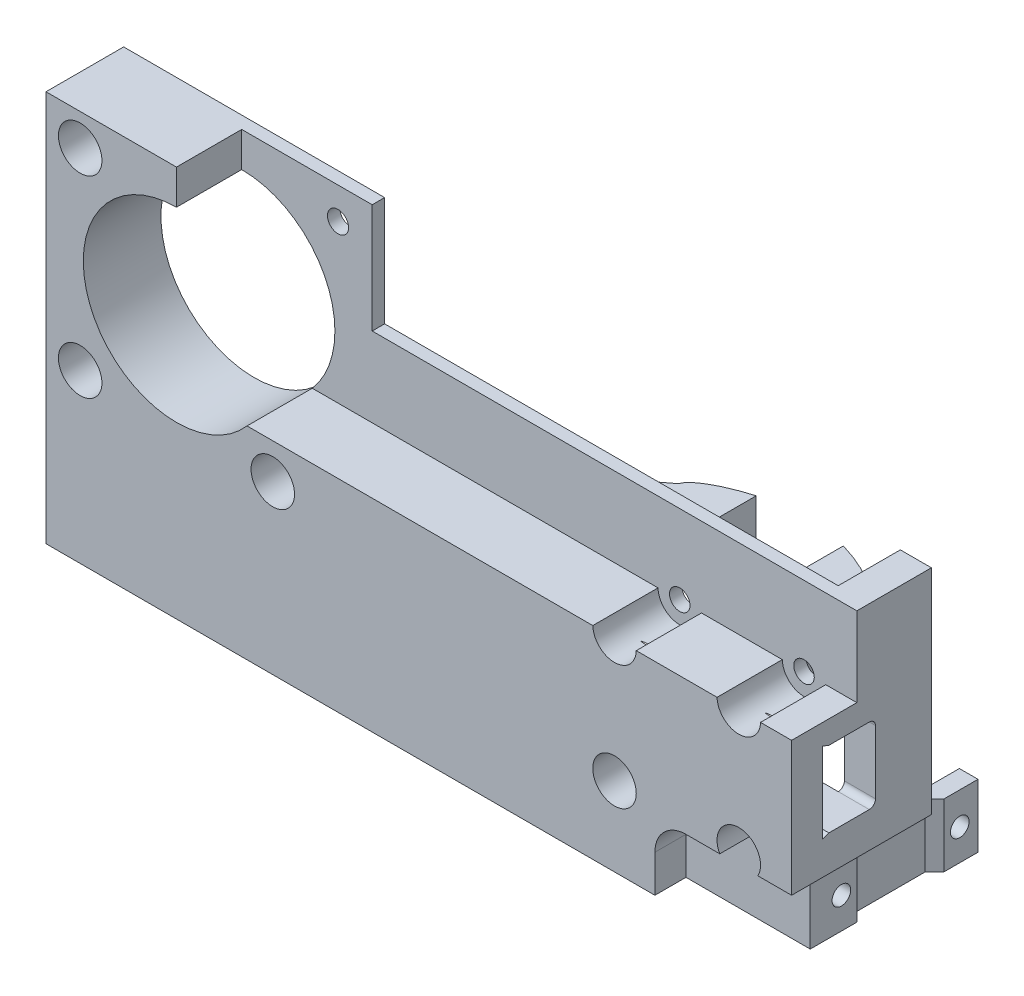
from build123d import *

# Parameters (mm, degrees)
SKETCH1_W               = 120
SKETCH1_H               = 45.4
BOSS_EXTRUDE1_DEPTH     = 12.5
SKETCH2_W               = 5
SKETCH2_H               = 45.4
BOSS_EXTRUDE2_DEPTH     = 10
CUT_EXTRUDE1_DEPTH      = 7.5
CUT_EXTRUDE1_DEPTH_BACK = 129.908533465
SKETCH3_W               = 78
SKETCH3_H               = 12.2
BOSS_EXTRUDE3_START     = -12.5
SKETCH4_W               = 42
SKETCH4_H               = 41
BOSS_EXTRUDE3_DEPTH     = 12.5
SKETCH5_R               = 15
SKETCH5_R_2             = 1.7
CUT_EXTRUDE2_DEPTH      = 138.38722648
SKETCH7_W               = 30
SKETCH7_H               = 8
BOSS_EXTRUDE4_DEPTH     = 44.5
SKETCH8_R               = 1.65
CUT_EXTRUDE4_DEPTH      = 148.030609058
FILLET1_SIZE            = 15
FILLET1_SIZE_2          = 6
SKETCH9_R               = 2.599999999
SKETCH9_R_2             = 12.000000007
CUT_EXTRUDE5_DEPTH      = 10
SKETCH10_R              = 3.5
CUT_EXTRUDE6_DEPTH      = 10.5
SKETCH12_R              = 3.5
CUT_EXTRUDE7_DEPTH      = 7.5
SKETCH6_W               = 105.644224039
SKETCH6_H               = 30.4
CUT_EXTRUDE3_DEPTH      = 10.5
CHAMFER1_SIZE           = 5
CHAMFER1_SIZE2          = 13.737387097
SKETCH13_W              = 14
SKETCH13_H              = 32.158687744
CUT_EXTRUDE8_DEPTH      = 10
SKETCH16_W              = 22.5
SKETCH16_H              = 11
CUT_EXTRUDE9_DEPTH      = 2
SKETCH18_W              = 3
SKETCH18_H              = 10.169703164
BOSS_EXTRUDE7_DEPTH     = 9.5
CUT_EXTRUDE10_REACH     = 144.298
SKETCH19_W              = 1.5
SKETCH19_H              = 14
SKETCH20_W              = 20
SKETCH20_H              = 5
CUT_EXTRUDE11_DEPTH     = 11
SKETCH21_R              = 1.5
CUT_EXTRUDE12_DEPTH     = 7
CHAMFER3_SIZE           = 1.5
FILLET3_R               = 5
CUT_EXTRUDE16_REACH     = 144.298
SKETCH24_W              = 5
SKETCH24_H              = 9
BOSS_EXTRUDE8_DEPTH     = 12.2
FILLET4_R               = 1
SKETCH15_R              = 2.75
BOSS_EXTRUDE9_DEPTH     = 2
CHAMFER4_SIZE           = 2
CHAMFER5_DEPTH          = 8


with BuildPart() as part:
    # Sketch1 → Boss-Extrude1 (new body)
    with BuildSketch(Plane.XY):
        with Locations((60, 22.7)):
            Rectangle(SKETCH1_W, SKETCH1_H)
    extrude(amount=BOSS_EXTRUDE1_DEPTH)

    # Sketch2 → Boss-Extrude2 (add)
    with BuildSketch(Plane(origin=(0, 0, 0), x_dir=(-1, 0, 0), z_dir=(0, 0, -1))):
        with Locations((-117.5, 22.7)):
            Rectangle(SKETCH2_W, SKETCH2_H)
    extrude(amount=BOSS_EXTRUDE2_DEPTH)

    # Sketch3 → Cut-Extrude1 (cut, two sides: drawn at the far end of the back side and taken through both)
    with BuildSketch(Plane.XY.offset(-CUT_EXTRUDE1_DEPTH_BACK)):
        with Locations((81, 22.8)):
            Rectangle(SKETCH3_W, SKETCH3_H)
    extrude(amount=CUT_EXTRUDE1_DEPTH + CUT_EXTRUDE1_DEPTH_BACK, mode=Mode.SUBTRACT)

    # Sketch4 → Boss-Extrude3 (add)
    with BuildSketch(Plane(origin=(0, 0, 0), x_dir=(-1, 0, 0), z_dir=(0, 0, -1)).offset(BOSS_EXTRUDE3_START)):
        with Locations((-21, 42.5)):
            Rectangle(SKETCH4_W, SKETCH4_H)
    extrude(amount=BOSS_EXTRUDE3_DEPTH)

    # Sketch5 → Cut-Extrude2 (cut, through all)
    with BuildSketch(Plane.XY.offset(12.5)):
        with Locations((21, 42.4)):
            Circle(SKETCH5_R)
        with Locations((5.5, 57.9)):
            Circle(SKETCH5_R_2)
        with Locations((36.5, 57.9)):
            Circle(SKETCH5_R_2)
        with Locations((36.5, 26.9)):
            Circle(SKETCH5_R_2)
        with Locations((5.5, 26.9)):
            Circle(SKETCH5_R_2)
    extrude(amount=-CUT_EXTRUDE2_DEPTH, mode=Mode.SUBTRACT)

    # Sketch7 → Boss-Extrude4 (add)
    with BuildSketch(Plane(origin=(0, 0, 0), x_dir=(-1, 0, 0), z_dir=(0, 0, -1))):
        with Locations((-65.5, 4)):
            Rectangle(SKETCH7_W, SKETCH7_H)
    extrude(amount=BOSS_EXTRUDE4_DEPTH)

    # Sketch8 → Cut-Extrude4 (cut, through all)
    with BuildSketch(Plane.XY.offset(12.5)):
        with Locations((91.5, 32.7)):
            Circle(SKETCH8_R)
        with Locations((111.5, 32.7)):
            Circle(SKETCH8_R)
        with Locations((111.5, 12.7)):
            Circle(SKETCH8_R)
        with Locations((91.5, 12.7)):
            Circle(SKETCH8_R)
    extrude(amount=-CUT_EXTRUDE4_DEPTH, mode=Mode.SUBTRACT)

    # Fillet1
    # a fillet whose section is not a circle: 15, 6 mm, written as the material it takes off along each edge
    with BuildSketch(Plane(origin=(50.5, -37.5, -44.5), x_dir=(1, 0, 0), z_dir=(0, 1, 0))) as fillet1_piece_1:
        with BuildLine():
            Bezier((FILLET1_SIZE, 0), (0, 0), (0, -FILLET1_SIZE_2), weights=[1, 0.428571429, 1])
            Line((0, -FILLET1_SIZE_2), (0, 0))
            Line((0, 0), (FILLET1_SIZE, 0))
        make_face()
    extrude(amount=83, mode=Mode.SUBTRACT)
    with BuildSketch(Plane(origin=(80.5, 45.5, -44.5), x_dir=(0, 0, 1), z_dir=(0, -1, 0))) as fillet1_piece_2:
        with BuildLine():
            Bezier((FILLET1_SIZE_2, 0), (0, 0), (0, FILLET1_SIZE), weights=[1, 0.428571429, 1])
            Line((0, FILLET1_SIZE), (0, 0))
            Line((0, 0), (FILLET1_SIZE_2, 0))
        make_face()
    extrude(amount=83, mode=Mode.SUBTRACT)

    # Sketch9 → Cut-Extrude5 (cut)
    with BuildSketch(Plane(origin=(0, 8, 0), x_dir=(1, 0, 0), z_dir=(0, 1, 0))):
        with Locations(Location((54.15539193, 34.815048574, 0), (0, 0, 180))):
            Circle(SKETCH9_R)
        with Locations(Location((65.469100429, 39.501340075, 0), (0, 0, 180))):
            Circle(SKETCH9_R)
        with Locations(Location((76.782808928, 34.815048574, 0), (0, 0, 180))):
            Circle(SKETCH9_R)
        with Locations(Location((65.469100429, 23.501340075, 0), (0, 0, 180))):
            Circle(SKETCH9_R_2)
    extrude(amount=-CUT_EXTRUDE5_DEPTH, mode=Mode.SUBTRACT)

    # Sketch10 → Cut-Extrude6 (cut)
    with BuildSketch(Plane.XY.offset(12.5)):
        with Locations((91.5, 32.7)):
            Circle(SKETCH10_R)
        with Locations((111.5, 32.7)):
            Circle(SKETCH10_R)
        with Locations((111.5, 12.7)):
            Circle(SKETCH10_R)
        with Locations((91.5, 12.7)):
            Circle(SKETCH10_R)
    extrude(amount=-CUT_EXTRUDE6_DEPTH, mode=Mode.SUBTRACT)

    # Sketch12 → Cut-Extrude7 (cut)
    with BuildSketch(Plane.XY.offset(12.5)):
        with Locations((36.5, 57.9)):
            Circle(SKETCH12_R)
        with Locations((5.5, 57.9)):
            Circle(SKETCH12_R)
        with Locations((5.5, 26.9)):
            Circle(SKETCH12_R)
        with Locations((36.5, 26.9)):
            Circle(SKETCH12_R)
    extrude(amount=-CUT_EXTRUDE7_DEPTH, mode=Mode.SUBTRACT)

    # Sketch6 → Cut-Extrude3 (cut)
    with BuildSketch(Plane.XY.offset(12.5)):
        with Locations((73.822112019, 47.8)):
            Rectangle(SKETCH6_W, SKETCH6_H)
    extrude(amount=-CUT_EXTRUDE3_DEPTH, mode=Mode.SUBTRACT)

    # Chamfer1
    chamfer1_edges = [part.edges().sort_by_distance(p)[0] for p in [
        (80.5, 4, 0),
    ]]
    chamfer1_side = [part.faces().sort_by_distance(p)[0] for p in [
        (40.688741063, 22.8, 0),
    ]]
    chamfer(chamfer1_edges, length=CHAMFER1_SIZE, length2=CHAMFER1_SIZE2, reference=chamfer1_side[0])

    # Sketch13 → Cut-Extrude8 (cut)
    with BuildSketch(Plane(origin=(0, 8, 0), x_dir=(1, 0, 0), z_dir=(0, 1, 0))):
        with Locations((65.469100429, 39.501340075)):
            Rectangle(SKETCH13_W, SKETCH13_H)
    extrude(amount=-CUT_EXTRUDE8_DEPTH, mode=Mode.SUBTRACT)

    # Sketch16 → Cut-Extrude9 (cut)
    with BuildSketch(Plane(origin=(120, 0, 0), x_dir=(0, 0, -1), z_dir=(1, 0, 0))):
        with Locations((-1.25, 5.5)):
            Rectangle(SKETCH16_W, SKETCH16_H)
    extrude(amount=-CUT_EXTRUDE9_DEPTH, mode=Mode.SUBTRACT)

    # Sketch18 → Boss-Extrude7 (add)
    with BuildSketch(Plane(origin=(0, 0, -10), x_dir=(-1, 0, 0), z_dir=(0, 0, -1))):
        with Locations((-116.5, 5.084851582)):
            Rectangle(SKETCH18_W, SKETCH18_H)
    extrude(amount=BOSS_EXTRUDE7_DEPTH)

    # Cut-Extrude10: up to this face of the body (flat: up to its plane)
    cut_extrude10_end = Plane(part.part.faces().sort_by_distance((119, 11, 1.25))[0])
    # Sketch19 → Cut-Extrude10 (cut, up to the picked face)
    with BuildSketch(Plane.XZ, mode=Mode.PRIVATE) as cut_extrude10_sk1:
        with Locations((117.25, -7)):
            Rectangle(SKETCH19_W, SKETCH19_H)
    cut_extrude10_tool1 = split(extrude(cut_extrude10_sk1.sketch, amount=-CUT_EXTRUDE10_REACH, mode=Mode.PRIVATE), bisect_by=cut_extrude10_end, keep=Keep.BOTH, mode=Mode.PRIVATE)
    add(cut_extrude10_tool1.solids().sort_by(Axis((117.25, 0, -7), (0, 1, 0)))[0], mode=Mode.SUBTRACT)

    # Sketch20 → Cut-Extrude11 (cut)
    with BuildSketch(Plane.XZ):
        with Locations((108, 10)):
            Rectangle(SKETCH20_W, SKETCH20_H)
    extrude(amount=-CUT_EXTRUDE11_DEPTH, mode=Mode.SUBTRACT)

    # Sketch21 → Cut-Extrude12 (cut)
    with BuildSketch(Plane(origin=(118, 0, 0), x_dir=(0, 0, -1), z_dir=(1, 0, 0))):
        with Locations((-2.485, 5)):
            Circle(SKETCH21_R)
        with Locations((16.565, 5)):
            Circle(SKETCH21_R)
    extrude(amount=-CUT_EXTRUDE12_DEPTH, mode=Mode.SUBTRACT)

    # Chamfer3
    chamfer3_edges = [part.edges().sort_by_distance(p)[0] for p in [
        (116.5, 5.084851582, -14),
        (116.5, 5.5, 0),
    ]]
    chamfer(chamfer3_edges, length=CHAMFER3_SIZE - 0.0001)  # a hair under: the kernel refuses the full size

    # Fillet3
    fillet3_edges = [part.edges().sort_by_distance(p)[0] for p in [
        (98, 11, 10),
    ]]
    fillet(fillet3_edges, radius=FILLET3_R)

    # Cut-Extrude16: up to this face of the body (flat: up to its plane)
    cut_extrude16_end = Plane(part.part.faces().sort_by_distance((42, 22.8, 3.75))[0])
    # Sketch23 → Cut-Extrude16 (cut, up to the picked face)
    with BuildSketch(Plane(origin=(120, 0, 0), x_dir=(0, 0, -1), z_dir=(1, 0, 0)), mode=Mode.PRIVATE) as cut_extrude16_sk1:
        Polygon((-6.5, 28.9), (-7.5, 28.9), (-7.5, 29.3), align=None)
    cut_extrude16_tool1 = split(extrude(cut_extrude16_sk1.sketch, amount=-CUT_EXTRUDE16_REACH, mode=Mode.PRIVATE), bisect_by=cut_extrude16_end, keep=Keep.BOTH, mode=Mode.PRIVATE)
    # Sketch23 → Cut-Extrude16 (cut, up to the picked face)
    with BuildSketch(Plane(origin=(120, 0, 0), x_dir=(0, 0, -1), z_dir=(1, 0, 0)), mode=Mode.PRIVATE) as cut_extrude16_sk2:
        Polygon((-7.5, 16.7), (-7.5, 16.3), (-6.5, 16.7), align=None)
    cut_extrude16_tool2 = split(extrude(cut_extrude16_sk2.sketch, amount=-CUT_EXTRUDE16_REACH, mode=Mode.PRIVATE), bisect_by=cut_extrude16_end, keep=Keep.BOTH, mode=Mode.PRIVATE)
    add(cut_extrude16_tool1.solids().sort_by(Axis((120, 29.033333, 7.166667), (-1, 0, 0)))[0], mode=Mode.SUBTRACT)
    add(cut_extrude16_tool2.solids().sort_by(Axis((120, 16.566667, 7.166667), (-1, 0, 0)))[0], mode=Mode.SUBTRACT)

    # Sketch24 → Boss-Extrude8 (add)
    with BuildSketch(Plane(origin=(0, 16.7, 0), x_dir=(1, 0, 0), z_dir=(0, 1, 0))):
        with Locations((117.5, 5.5)):
            Rectangle(SKETCH24_W, SKETCH24_H)
    extrude(amount=BOSS_EXTRUDE8_DEPTH)

    # Fillet4
    fillet4_edges = [part.edges().sort_by_distance(p)[0] for p in [
        (117.5, 28.9, -1),
        (117.5, 16.7, -1),
    ]]
    fillet(fillet4_edges, radius=FILLET4_R)

    # Sketch15 → Boss-Extrude9 (add)
    with BuildSketch(Plane(origin=(0, 8, 0), x_dir=(1, 0, 0), z_dir=(0, 1, 0))):
        with Locations((65.469100428, 7.501340074)):
            Circle(SKETCH15_R)
    extrude(amount=BOSS_EXTRUDE9_DEPTH)

    # Chamfer4
    chamfer4_edges = [part.edges().sort_by_distance(p)[0] for p in [
        (62.719100428, 10, -7.501340074),
    ]]
    chamfer(chamfer4_edges, length=CHAMFER4_SIZE - 0.0001)  # a hair under: the kernel refuses the full size

    # Chamfer5: read off the stored shape, not the designer's step
    # Chamfer5 outline → Chamfer5 (add)
    with BuildSketch(Plane(origin=(0, 0, 0), x_dir=(1, 0, 0), z_dir=(0, 1, 0))):
        with BuildLine():
            add(Edge.make_bspline(
                [(50.541922163, 38.782180687), (50.5, 38.636096407), (50.5, 38.5)],
                knots=[0.948627317, 0.948627317, 0.948627317, 1, 1, 1], degree=2, weights=[0.944304536, 0.970644181, 1]))
            Line((50.541922163, 38.782180687), (0, 0))
            Line((0, 0), (50.5, 0))
            Line((50.5, 0), (50.5, 38.5))
        make_face()
    extrude(amount=CHAMFER5_DEPTH)


solid = part.part
